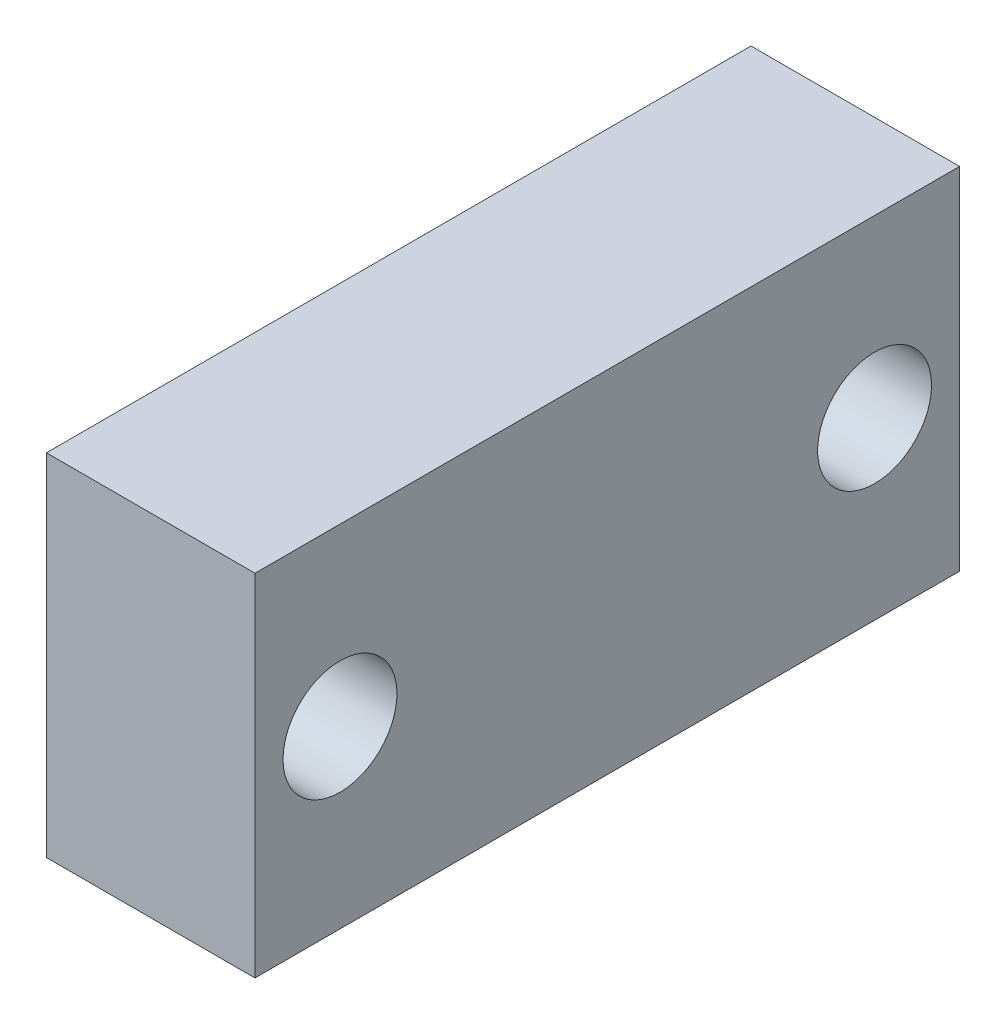
from build123d import *

# Parameters (mm, degrees)
SKETCH1_W           = 40.2
SKETCH1_H           = 20
BOSS_EXTRUDE1_DEPTH = 11.9
SKETCH2_R           = 2.35
CUT_EXTRUDE1_DEPTH  = 10
SKETCH3_R           = 2
CUT_EXTRUDE3_DEPTH  = 26.409053505
SKETCH5_R           = 3.25
CUT_EXTRUDE4_DEPTH  = 9
CHAMFER1_SIZE       = 1


with BuildPart() as part:
    # Sketch1 → Boss-Extrude1 (new body)
    with BuildSketch(Plane(origin=(0, 0, 0), x_dir=(0, 0, -1), z_dir=(1, 0, 0))):
        Rectangle(SKETCH1_W, SKETCH1_H)
    extrude(amount=BOSS_EXTRUDE1_DEPTH)

    # Sketch2 → Cut-Extrude1 (cut)
    with BuildSketch(Plane.XZ.offset(10)):
        with Locations((3.89, -4.9)):
            Circle(SKETCH2_R)
        with Locations((3.89, 4.9)):
            Circle(SKETCH2_R)
    extrude(amount=-CUT_EXTRUDE1_DEPTH, mode=Mode.SUBTRACT)

    # Sketch3 → Cut-Extrude3 (cut, through all)
    with BuildSketch(Plane(origin=(11.9, 0, 0), x_dir=(0, 0, -1), z_dir=(1, 0, 0))):
        with Locations((15.25, 0)):
            Circle(SKETCH3_R)
        with Locations((-15.25, 0)):
            Circle(SKETCH3_R)
    extrude(amount=-CUT_EXTRUDE3_DEPTH, mode=Mode.SUBTRACT)

    # Sketch5 → Cut-Extrude4 (cut)
    with BuildSketch(Plane(origin=(11.9, 0, 0), x_dir=(0, 0, -1), z_dir=(1, 0, 0))):
        with Locations((15.25, 0)):
            Circle(SKETCH5_R)
        with Locations((-15.25, 0)):
            Circle(SKETCH5_R)
    extrude(amount=-CUT_EXTRUDE4_DEPTH, mode=Mode.SUBTRACT)

    # Chamfer1
    chamfer1_edges = [part.edges().sort_by_distance(p)[0] for p in [
        (1.54, -10, 4.9),
        (1.54, -10, -4.9),
    ]]
    chamfer(chamfer1_edges, length=CHAMFER1_SIZE)


solid = part.part
